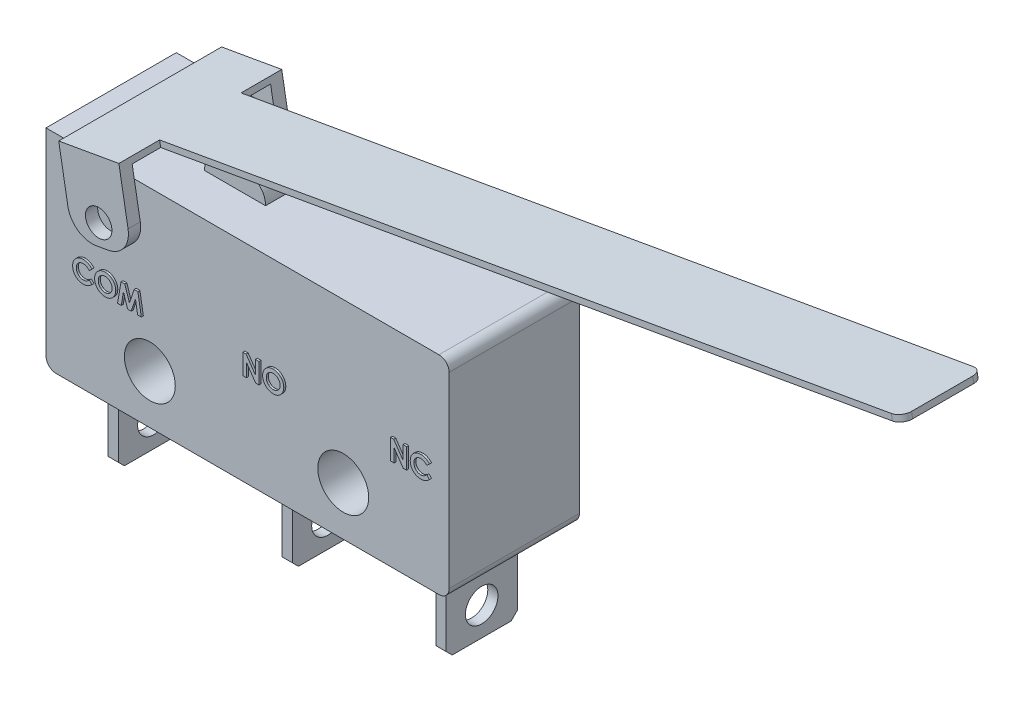
from build123d import *

# Parameters (mm, degrees)
SKETCH1_R           = 1.25
BOSS_EXTRUDE2_DEPTH = 3.2
SKETCH2_W           = 0.5
SKETCH2_H           = 3.5
BOSS_EXTRUDE3_DEPTH = 4
CHAMFER4_SIZE       = 0.3
SKETCH3_R           = 0.8
CUT_EXTRUDE1_DEPTH  = 21.598300901
SKETCH7_W           = 3
SKETCH7_H           = 2
BOSS_EXTRUDE4_DEPTH = 1
FILLET5_R           = 1
SKETCH5_W           = 2
SKETCH5_H           = 3
BOSS_EXTRUDE6_DEPTH = 0.3
SKETCH9_W           = 3
SKETCH9_H           = 0.6
BOSS_EXTRUDE7_DEPTH = 3.5
FILLET6_R           = 1.2
SKETCH13_R          = 0.65
CUT_EXTRUDE2_DEPTH  = 0.6
SKETCH14_R          = 0.65
CUT_EXTRUDE3_DEPTH  = 0.6
BOSS_EXTRUDE8_DEPTH = 0.1


with BuildPart() as part:
    # Sketch1 → Boss-Extrude2 (new, symmetric)
    with BuildSketch(Plane.XY):
        with BuildLine():
            Line((9.65, 5.1), (-9.65, 5.1))
            Line((-9.65, 5.1), (-9.65, -4.6))
            ThreePointArc((-9.65, -4.6), (-9.503553391, -4.953553391), (-9.15, -5.1))
            Line((-9.15, -5.1), (9.65, -5.1))
            ThreePointArc((9.65, -5.1), (10.003553391, -4.953553391), (10.15, -4.6))
            Line((10.15, -4.6), (10.15, 4.6))
            ThreePointArc((10.15, 4.6), (10.003553391, 4.953553391), (9.65, 5.1))
        make_face()
        with Locations((-4.55, -2.7)):
            Circle(SKETCH1_R, mode=Mode.SUBTRACT)
        with Locations((4.95, -2.7)):
            Circle(SKETCH1_R, mode=Mode.SUBTRACT)
    extrude(amount=BOSS_EXTRUDE2_DEPTH, both=True)

    # Sketch2 → Boss-Extrude3 (add)
    with BuildSketch(Plane.XZ.offset(5.1)):
        with Locations((-7.8, 0)):
            Rectangle(SKETCH2_W, SKETCH2_H)
        with Locations((0.75, 0)):
            Rectangle(SKETCH2_W, SKETCH2_H)
        with Locations((8.3, 0)):
            Rectangle(SKETCH2_W, SKETCH2_H)
    extrude(amount=BOSS_EXTRUDE3_DEPTH)

    # Chamfer4
    chamfer4_edges = [part.edges().sort_by_distance(p)[0] for p in [
        (-7.8, -9.1, -1.75),
        (-7.8, -9.1, 1.75),
        (0.75, -9.1, -1.75),
        (0.75, -9.1, 1.75),
        (8.3, -9.1, 1.75),
        (8.3, -9.1, -1.75),
    ]]
    chamfer(chamfer4_edges, length=CHAMFER4_SIZE)

    # Sketch3 → Cut-Extrude1 (cut, through all)
    with BuildSketch(Plane.ZY.offset(8.05)):
        with Locations(Location((0, -7.7, 0), (0, 0, 270))):
            Circle(SKETCH3_R)
    extrude(amount=-CUT_EXTRUDE1_DEPTH, mode=Mode.SUBTRACT)

    # Sketch7 → Boss-Extrude4 (add)
    with BuildSketch(Plane(origin=(0, 5.1, 0), x_dir=(1, 0, 0), z_dir=(0, 1, 0))):
        with Locations((-2.445461134, -0.11924782)):
            Rectangle(SKETCH7_W, SKETCH7_H)
    extrude(amount=BOSS_EXTRUDE4_DEPTH)

    # Fillet5
    fillet5_edges = [part.edges().sort_by_distance(p)[0] for p in [
        (-0.945461134, 6.1, 0.11924782),
        (-3.945461134, 6.1, 0.11924782),
    ]]
    fillet(fillet5_edges, radius=FILLET5_R - 0.0001)  # a hair under: the kernel refuses the full size

    # Sketch15 → Boss-Extrude8 (add)
    # profile 1 of 7: a face of its own
    with BuildSketch(Plane.XY.offset(3.2)):
        with BuildLine():
            Line((-7.291117841, 0.3205553), (-7.422728417, 0.194754018))
            add(Edge.make_bspline(
                [(-7.422728417, 0.194754018), (-7.433892699, 0.206297903), (-7.455700038, 0.228846728), (-7.490839868, 0.258699386), (-7.527384012, 0.283577536), (-7.564621576, 0.304529757), (-7.603222356, 0.320381604), (-7.642740022, 0.331933113), (-7.683426907, 0.338975631), (-7.710962225, 0.33978142), (-7.724811751, 0.34018671)],
                knots=[0, 0, 0, 0, 1.115251505, 2.178435587, 3.19620269, 4.182487026, 5.141301733, 6.088180966, 7.038406374, 8, 8, 8, 8], degree=3))
            add(Edge.make_bspline(
                [(-7.724811751, 0.34018671), (-7.736377788, 0.339866516), (-7.759202087, 0.33923465), (-7.79271414, 0.334602447), (-7.824770151, 0.326725185), (-7.855479852, 0.315868858), (-7.884752878, 0.301821347), (-7.912650605, 0.284593524), (-7.939104252, 0.264340982), (-7.963764381, 0.241168507), (-7.986322601, 0.215850837), (-8.006254224, 0.188836944), (-8.022950156, 0.160188714), (-8.036652235, 0.130196277), (-8.047325626, 0.098720812), (-8.054947767, 0.065783509), (-8.05935621, 0.031345144), (-8.0600142, 0.007934199), (-8.06034861, -0.003963931)],
                knots=[0, 0, 0, 0, 1.035432265, 2.043311493, 3.022114605, 3.98653278, 4.95457646, 5.923598177, 6.917315552, 7.932509744, 8.948865224, 9.949768934, 10.933144597, 11.912367597, 12.897413939, 13.903909035, 14.934704909, 16, 16, 16, 16], degree=3))
            add(Edge.make_bspline(
                [(-8.06034861, -0.003963931), (-8.060252237, -0.012314872), (-8.060062283, -0.028774747), (-8.057982909, -0.053123471), (-8.054634625, -0.07674749), (-8.049788829, -0.099611019), (-8.043729114, -0.121733872), (-8.036619688, -0.143306902), (-8.027701018, -0.164032019), (-8.01780116, -0.18414993), (-8.006287739, -0.203111694), (-7.993874146, -0.22119331), (-7.980413633, -0.238306143), (-7.965819012, -0.254380236), (-7.949884885, -0.269164387), (-7.933023088, -0.283103171), (-7.914949187, -0.295847656), (-7.896038622, -0.307717676), (-7.87612803, -0.318029264), (-7.855757631, -0.327369571), (-7.83461857, -0.334955289), (-7.812968226, -0.341070069), (-7.790883972, -0.346269777), (-7.768149801, -0.349471396), (-7.744962791, -0.351895946), (-7.729292265, -0.352045647), (-7.721406302, -0.352120982)],
                knots=[0, 0, 0, 0, 1.103660481, 2.175337485, 3.227646561, 4.255952547, 5.262355991, 6.258840057, 7.255597736, 8.242457506, 9.22035537, 10.185017736, 11.140346927, 12.096287581, 13.051739095, 14.01125915, 14.986044842, 15.97314143, 16.960198552, 17.947847494, 18.933482797, 19.925264591, 20.920966487, 21.929612487, 22.958107872, 24, 24, 24, 24], degree=3))
            add(Edge.make_bspline(
                [(-7.721406302, -0.352120982), (-7.708030354, -0.351734079), (-7.681750095, -0.350973915), (-7.643180037, -0.345029535), (-7.606426613, -0.335251368), (-7.577060804, -0.323703921), (-7.554053468, -0.312300666), (-7.536538323, -0.301753218), (-7.518426298, -0.289954738), (-7.500018218, -0.276459941), (-7.481107029, -0.261430769), (-7.462026557, -0.244538054), (-7.442288339, -0.22633805), (-7.429358027, -0.21334835), (-7.422728417, -0.20668829)],
                knots=[0, 0, 0, 0, 1.404581149, 2.759636711, 4.088442092, 5.392261763, 6.066678138, 6.783632037, 7.538459478, 8.336747902, 9.180226004, 10.074962426, 11.012997595, 12, 12, 12, 12], degree=3))
            Line((-7.422728417, -0.20668829), (-7.295124251, -0.340702713))
            add(Edge.make_bspline(
                [(-7.295124251, -0.340702713), (-7.304094137, -0.349362857), (-7.321601436, -0.366265605), (-7.348010711, -0.390265929), (-7.374386749, -0.411832889), (-7.40009236, -0.43174927), (-7.425548628, -0.44943486), (-7.450752854, -0.464907321), (-7.475419715, -0.478557974), (-7.500061426, -0.490156608), (-7.524831322, -0.500005053), (-7.550316633, -0.508483918), (-7.576595271, -0.515656732), (-7.603827734, -0.521444252), (-7.631760015, -0.526085061), (-7.660653521, -0.52921758), (-7.690325055, -0.531323469), (-7.710451716, -0.5315127), (-7.72060502, -0.531608162)],
                knots=[0, 0, 0, 0, 1.244526981, 2.429050516, 3.560637417, 4.644440555, 5.67424972, 6.652764056, 7.595344123, 8.486817594, 9.369275933, 10.254498637, 11.166417451, 12.086725134, 13.032340136, 13.991389299, 14.986715468, 16, 16, 16, 16], degree=3))
            add(Edge.make_bspline(
                [(-7.72060502, -0.531608162), (-7.739255381, -0.531132727), (-7.775748954, -0.530202433), (-7.829229333, -0.523309585), (-7.880034257, -0.511753846), (-7.928287326, -0.495410844), (-7.973973196, -0.474533426), (-8.017080179, -0.44893869), (-8.057538796, -0.41869464), (-8.095022221, -0.384155764), (-8.128927764, -0.346010475), (-8.158896337, -0.3050529), (-8.183686341, -0.261081746), (-8.204270016, -0.214746609), (-8.220366179, -0.165836043), (-8.231695149, -0.114297141), (-8.238681643, -0.060179669), (-8.239445975, -0.023216187), (-8.239835789, -0.004364572)],
                knots=[0, 0, 0, 0, 1.078019885, 2.10938526, 3.111377082, 4.085535484, 5.04941344, 6.010039228, 6.978205633, 7.964457913, 8.951525778, 9.924444315, 10.892603023, 11.863865945, 12.85144698, 13.863884204, 14.910567087, 16, 16, 16, 16], degree=3))
            add(Edge.make_bspline(
                [(-8.239835789, -0.004364572), (-8.239671073, 0.00793029), (-8.239344644, 0.032295703), (-8.235913854, 0.06818793), (-8.231131132, 0.103176431), (-8.223543779, 0.13689791), (-8.214397973, 0.169806657), (-8.203023962, 0.201544992), (-8.189439911, 0.232204135), (-8.174083667, 0.261835411), (-8.156711302, 0.290244704), (-8.137304463, 0.317187931), (-8.116362757, 0.342873092), (-8.093382991, 0.366959423), (-8.068699089, 0.389658409), (-8.042199607, 0.410847037), (-8.014043927, 0.430829179), (-7.98415584, 0.449089542), (-7.953115993, 0.465607011), (-7.921315881, 0.480176124), (-7.888833631, 0.492352547), (-7.855806583, 0.502452441), (-7.822095198, 0.509991298), (-7.787940098, 0.515697969), (-7.753050665, 0.518888035), (-7.729625433, 0.519410269), (-7.717800533, 0.519673889)],
                knots=[0, 0, 0, 0, 1.071919942, 2.124283339, 3.142214191, 4.149696895, 5.136002878, 6.119640489, 7.086990633, 8.058538607, 9.028339693, 9.988281803, 10.952401235, 11.916291999, 12.888973767, 13.874849856, 14.873389453, 15.898127285, 16.927174885, 17.938320013, 18.946391617, 19.950418109, 20.947802303, 21.956882652, 22.968648068, 24, 24, 24, 24], degree=3))
            add(Edge.make_bspline(
                [(-7.717800533, 0.519673889), (-7.707712681, 0.519522776), (-7.687641862, 0.519222119), (-7.657753045, 0.516715822), (-7.628103265, 0.512779707), (-7.598798677, 0.506840949), (-7.569629665, 0.499790892), (-7.540979542, 0.490559815), (-7.512396337, 0.48027004), (-7.484328335, 0.467970715), (-7.456736357, 0.454544891), (-7.43026679, 0.439312806), (-7.40447521, 0.423211825), (-7.379933145, 0.405289023), (-7.356180868, 0.386194491), (-7.333342583, 0.365839145), (-7.311618707, 0.3438836), (-7.29798601, 0.328370711), (-7.291117841, 0.3205553)],
                knots=[0, 0, 0, 0, 0.996412454, 1.982464992, 2.961075852, 3.949442424, 4.934965278, 5.923860011, 6.921385422, 7.934793307, 8.949617135, 9.951082467, 10.950285876, 11.951772932, 12.951063433, 13.960125323, 14.972308753, 16, 16, 16, 16], degree=3))
        make_face()
    # profile 2 of 7: a face of its own
    with BuildSketch(Plane.XY.offset(3.2)):
        with BuildLine():
            add(Edge.make_bspline(
                [(-6.641678738, 0.519673889), (-6.624292512, 0.519223729), (-6.589968165, 0.51833501), (-6.539489437, 0.510926845), (-6.490843849, 0.498856302), (-6.444053398, 0.482077375), (-6.399235243, 0.460135604), (-6.356231294, 0.433653054), (-6.315195591, 0.402129881), (-6.276548633, 0.36630147), (-6.240831874, 0.327339638), (-6.209883281, 0.285390298), (-6.183491456, 0.241540401), (-6.161617842, 0.19567245), (-6.144957013, 0.147468786), (-6.13326542, 0.097175185), (-6.125754151, 0.044805956), (-6.124890239, 0.009149648), (-6.124451174, -0.008971944)],
                knots=[0, 0, 0, 0, 1.014329547, 2.002516266, 2.970391464, 3.935626869, 4.897733899, 5.877609409, 6.878433252, 7.912639331, 8.949961323, 9.958554974, 10.949718813, 11.932905612, 12.9188844, 13.919928257, 14.942845884, 16, 16, 16, 16], degree=3))
            add(Edge.make_bspline(
                [(-6.124451174, -0.008971944), (-6.12491876, -0.026889348), (-6.125840152, -0.062196167), (-6.132958777, -0.114082794), (-6.144847258, -0.163837645), (-6.161225506, -0.211573343), (-6.182702416, -0.257058671), (-6.208579571, -0.300584047), (-6.23953982, -0.341745546), (-6.274453922, -0.380521078), (-6.312891317, -0.415718194), (-6.353602621, -0.446735591), (-6.396399853, -0.473018564), (-6.441220373, -0.494555072), (-6.488160294, -0.511268762), (-6.537103672, -0.523061485), (-6.588047475, -0.530228161), (-6.622691732, -0.531143536), (-6.640276494, -0.531608162)],
                knots=[0, 0, 0, 0, 1.051557043, 2.072126891, 3.067553643, 4.050577992, 5.02905126, 6.015227836, 7.017913613, 8.04756643, 9.074058332, 10.072836633, 11.047628519, 12.017157415, 12.98668631, 13.966869689, 14.968021931, 16, 16, 16, 16], degree=3))
            add(Edge.make_bspline(
                [(-6.640276494, -0.531608162), (-6.658668047, -0.531191369), (-6.694804935, -0.530372428), (-6.747691432, -0.522584674), (-6.798361265, -0.510853596), (-6.84638878, -0.493345591), (-6.892263095, -0.471459113), (-6.935647159, -0.444504603), (-6.976526391, -0.412526606), (-7.014666301, -0.376344089), (-7.049221152, -0.33675248), (-7.079722586, -0.294927456), (-7.105451222, -0.251188523), (-7.126408002, -0.205515211), (-7.142929485, -0.158191368), (-7.154583514, -0.108928779), (-7.161467827, -0.057845592), (-7.162426772, -0.02314887), (-7.162912712, -0.005566495)],
                knots=[0, 0, 0, 0, 1.067978421, 2.098431617, 3.099715153, 4.085208694, 5.062210972, 6.048429807, 7.046490867, 8.072918869, 9.098532598, 10.095778865, 11.076610158, 12.041847152, 13.011192615, 13.984257998, 14.978533688, 16, 16, 16, 16], degree=3))
            add(Edge.make_bspline(
                [(-7.162912712, -0.005566495), (-7.162760196, 0.006262006), (-7.162457096, 0.029769233), (-7.158805927, 0.064605744), (-7.153549295, 0.098762293), (-7.145774984, 0.132102697), (-7.136331185, 0.164862158), (-7.124095408, 0.196735742), (-7.110167782, 0.228063947), (-7.093894664, 0.258476747), (-7.075800529, 0.28769432), (-7.056058217, 0.315578841), (-7.034618086, 0.341793145), (-7.011549202, 0.366509502), (-6.986772066, 0.389565449), (-6.960612597, 0.411287376), (-6.932563451, 0.431098271), (-6.903238538, 0.449481955), (-6.872803184, 0.466106002), (-6.841381289, 0.480255894), (-6.809620207, 0.492612753), (-6.777095651, 0.502365333), (-6.74415618, 0.510308707), (-6.710449903, 0.515561797), (-6.676281336, 0.519212864), (-6.65324031, 0.519519849), (-6.641678738, 0.519673889)],
                knots=[0, 0, 0, 0, 1.034744296, 2.056386356, 3.06226378, 4.057406941, 5.050368692, 6.043467995, 7.042652155, 8.049140477, 9.059438543, 10.048523776, 11.036952808, 12.020949711, 13.004946614, 13.997082645, 14.994316842, 16.007702937, 17.024872941, 18.026463647, 19.021641123, 20.005082605, 20.995858141, 21.984425357, 22.988620895, 24, 24, 24, 24], degree=3))
        make_face()
        with BuildLine():
            add(Edge.make_bspline(
                [(-6.644483225, 0.34018671), (-6.656184153, 0.339872748), (-6.679277101, 0.339253112), (-6.713150251, 0.334532326), (-6.745669672, 0.326992695), (-6.776655094, 0.316071631), (-6.806240812, 0.302171889), (-6.834479272, 0.285342035), (-6.860979431, 0.265003563), (-6.88609464, 0.242248354), (-6.9087821, 0.216893821), (-6.928827186, 0.189722128), (-6.945601694, 0.16077865), (-6.95965045, 0.130332265), (-6.970226049, 0.098040612), (-6.977758732, 0.064156634), (-6.982519106, 0.028621949), (-6.983119157, 0.004398), (-6.983425533, -0.007970341)],
                knots=[0, 0, 0, 0, 1.033739768, 2.040188636, 3.016340934, 3.979330865, 4.937572243, 5.900995986, 6.878200029, 7.884839167, 8.891893314, 9.879764717, 10.863503415, 11.843163062, 12.837761627, 13.859916423, 14.907309254, 16, 16, 16, 16], degree=3))
            add(Edge.make_bspline(
                [(-6.983425533, -0.007970341), (-6.983019325, -0.021677246), (-6.982223225, -0.048540508), (-6.976621769, -0.087727911), (-6.967038234, -0.124736524), (-6.953199797, -0.159385343), (-6.936036505, -0.192059117), (-6.914722419, -0.222357383), (-6.889602728, -0.250461553), (-6.870250721, -0.266869938), (-6.860428738, -0.275197906)],
                knots=[0, 0, 0, 0, 1.078454662, 2.113592447, 3.107694534, 4.079536787, 5.043276885, 6.005368276, 6.987637804, 8, 8, 8, 8], degree=3))
            add(Edge.make_bspline(
                [(-6.860428738, -0.275197906), (-6.852382658, -0.281350288), (-6.836471779, -0.293516439), (-6.811074551, -0.309109858), (-6.784920407, -0.322474973), (-6.757811982, -0.333273828), (-6.729806526, -0.341768026), (-6.700907881, -0.347716373), (-6.671156992, -0.351449475), (-6.651038048, -0.351895652), (-6.640877456, -0.352120982)],
                knots=[0, 0, 0, 0, 1.023928204, 2.024787132, 3.009472467, 3.9914905, 4.972207045, 5.96565515, 6.972602802, 8, 8, 8, 8], degree=3))
            add(Edge.make_bspline(
                [(-6.640877456, -0.352120982), (-6.629377726, -0.351804358), (-6.606751646, -0.35118139), (-6.573509063, -0.34651872), (-6.541661659, -0.338627799), (-6.511011722, -0.327802538), (-6.481647634, -0.313728273), (-6.453712904, -0.29637641), (-6.427158555, -0.275960008), (-6.402075341, -0.252905973), (-6.379148099, -0.227451561), (-6.359144843, -0.200134937), (-6.341836989, -0.171557967), (-6.328080377, -0.141316187), (-6.317086959, -0.109695066), (-6.309644937, -0.076554561), (-6.304844348, -0.04203129), (-6.304244128, -0.018536983), (-6.303938353, -0.006568098)],
                knots=[0, 0, 0, 0, 1.026359118, 2.019393844, 2.989460624, 3.950973911, 4.916101784, 5.890408035, 6.881132271, 7.902007068, 8.92769091, 9.933912415, 10.920395702, 11.90457117, 12.894218921, 13.903490204, 14.931958862, 16, 16, 16, 16], degree=3))
            add(Edge.make_bspline(
                [(-6.303938353, -0.006568098), (-6.304254708, 0.005331963), (-6.304877404, 0.028755419), (-6.309548281, 0.063189931), (-6.31738916, 0.096184131), (-6.328246927, 0.1277919), (-6.342111721, 0.158044227), (-6.359256946, 0.186834726), (-6.37962244, 0.214135563), (-6.402739494, 0.239760695), (-6.427900986, 0.26330855), (-6.454914362, 0.283743807), (-6.483023757, 0.301501396), (-6.512874138, 0.315411974), (-6.543854791, 0.326494502), (-6.576154761, 0.334655835), (-6.609896388, 0.339219948), (-6.632851514, 0.339861583), (-6.644483225, 0.34018671)],
                knots=[0, 0, 0, 0, 1.055025985, 2.07665775, 3.074803781, 4.057872707, 5.035505728, 6.020516407, 7.023567878, 8.050795229, 9.077271434, 10.074415901, 11.050397877, 12.019801805, 12.988065821, 13.964604439, 14.968634123, 16, 16, 16, 16], degree=3))
        make_face(mode=Mode.SUBTRACT)
    # profile 3 of 7: a face of its own
    with BuildSketch(Plane.XY.offset(3.2)):
        Polygon((-5.865837392, 0.494032864), (-5.679539315, 0.494032864), (-5.451374251, -0.203483162), (-5.221606623, 0.494032864), (-5.03711143, 0.494032864), (-4.868040917, -0.505967136), (-5.049731623, -0.505967136), (-5.156502456, 0.125643441), (-5.364435148, -0.505967136), (-5.539515276, -0.505967136), (-5.746246046, 0.125643441), (-5.852816559, -0.505967136), (-6.034707584, -0.505967136), align=None)
    # profile 4 of 7: a face of its own
    with BuildSketch(Plane.XY.offset(3.2)):
        Polygon((0.115384615, 0.494032864), (0.277043269, 0.494032864), (0.730769231, -0.164020021), (0.730769231, 0.494032864), (0.91025641, 0.494032864), (0.91025641, -0.505967136), (0.747395833, -0.505967136), (0.294871795, 0.150082543), (0.294871795, -0.505967136), (0.115384615, -0.505967136), align=None)
    # profile 5 of 7: a face of its own
    with BuildSketch(Plane.XY.offset(3.2)):
        with BuildLine():
            add(Edge.make_bspline(
                [(1.610977564, 0.519673889), (1.62836379, 0.519223729), (1.662688137, 0.51833501), (1.713166865, 0.510926845), (1.761812453, 0.498856302), (1.808602904, 0.482077375), (1.853421059, 0.460135604), (1.896425008, 0.433653054), (1.937460712, 0.402129881), (1.976107669, 0.36630147), (2.011824429, 0.327339638), (2.042773021, 0.285390298), (2.069164846, 0.241540401), (2.09103846, 0.19567245), (2.107699289, 0.147468786), (2.119390882, 0.097175185), (2.126902151, 0.044805956), (2.127766063, 0.009149648), (2.128205128, -0.008971944)],
                knots=[0, 0, 0, 0, 1.014329547, 2.002516266, 2.970391464, 3.935626869, 4.897733899, 5.877609409, 6.878433252, 7.912639331, 8.949961323, 9.958554974, 10.949718813, 11.932905612, 12.9188844, 13.919928257, 14.942845884, 16, 16, 16, 16], degree=3))
            add(Edge.make_bspline(
                [(2.128205128, -0.008971944), (2.127737543, -0.026889348), (2.12681615, -0.062196167), (2.119697525, -0.114082794), (2.107809044, -0.163837645), (2.091430796, -0.211573343), (2.069953886, -0.257058671), (2.044076731, -0.300584047), (2.013116482, -0.341745546), (1.97820238, -0.380521078), (1.939764985, -0.415718194), (1.899053681, -0.446735591), (1.856256449, -0.473018564), (1.81143593, -0.494555072), (1.764496008, -0.511268762), (1.715552631, -0.523061485), (1.664608827, -0.530228161), (1.62996457, -0.531143536), (1.612379808, -0.531608162)],
                knots=[0, 0, 0, 0, 1.051557043, 2.072126891, 3.067553643, 4.050577992, 5.02905126, 6.015227836, 7.017913613, 8.04756643, 9.074058332, 10.072836633, 11.047628519, 12.017157415, 12.98668631, 13.966869689, 14.968021931, 16, 16, 16, 16], degree=3))
            add(Edge.make_bspline(
                [(1.612379808, -0.531608162), (1.593988255, -0.531191369), (1.557851367, -0.530372428), (1.50496487, -0.522584674), (1.454295037, -0.510853596), (1.406267522, -0.493345591), (1.360393207, -0.471459113), (1.317009143, -0.444504603), (1.276129911, -0.412526606), (1.237990001, -0.376344089), (1.20343515, -0.33675248), (1.172933716, -0.294927456), (1.14720508, -0.251188523), (1.1262483, -0.205515211), (1.109726817, -0.158191368), (1.098072788, -0.108928779), (1.091188475, -0.057845592), (1.09022953, -0.02314887), (1.08974359, -0.005566495)],
                knots=[0, 0, 0, 0, 1.067978421, 2.098431617, 3.099715153, 4.085208694, 5.062210972, 6.048429807, 7.046490867, 8.072918869, 9.098532598, 10.095778865, 11.076610158, 12.041847152, 13.011192615, 13.984257998, 14.978533688, 16, 16, 16, 16], degree=3))
            add(Edge.make_bspline(
                [(1.08974359, -0.005566495), (1.089896106, 0.006262006), (1.090199207, 0.029769233), (1.093850375, 0.064605744), (1.099107007, 0.098762293), (1.106881318, 0.132102697), (1.116325118, 0.164862158), (1.128560894, 0.196735742), (1.14248852, 0.228063947), (1.158761638, 0.258476747), (1.176855773, 0.28769432), (1.196598085, 0.315578841), (1.218038216, 0.341793145), (1.2411071, 0.366509502), (1.265884236, 0.389565449), (1.292043706, 0.411287376), (1.320092851, 0.431098271), (1.349417764, 0.449481955), (1.379853118, 0.466106002), (1.411275013, 0.480255894), (1.443036095, 0.492612753), (1.475560651, 0.502365333), (1.508500122, 0.510308707), (1.542206399, 0.515561797), (1.576374966, 0.519212864), (1.599415992, 0.519519849), (1.610977564, 0.519673889)],
                knots=[0, 0, 0, 0, 1.034744296, 2.056386356, 3.06226378, 4.057406941, 5.050368692, 6.043467995, 7.042652155, 8.049140477, 9.059438543, 10.048523776, 11.036952808, 12.020949711, 13.004946614, 13.997082645, 14.994316842, 16.007702937, 17.024872941, 18.026463647, 19.021641123, 20.005082605, 20.995858141, 21.984425357, 22.988620895, 24, 24, 24, 24], degree=3))
        make_face()
        with BuildLine():
            add(Edge.make_bspline(
                [(1.608173077, 0.34018671), (1.596472149, 0.339872748), (1.573379201, 0.339253112), (1.539506051, 0.334532326), (1.506986631, 0.326992695), (1.476001208, 0.316071631), (1.44641549, 0.302171889), (1.41817703, 0.285342035), (1.391676872, 0.265003563), (1.366561662, 0.242248354), (1.343874203, 0.216893821), (1.323829117, 0.189722128), (1.307054608, 0.16077865), (1.293005852, 0.130332265), (1.282430253, 0.098040612), (1.27489757, 0.064156634), (1.270137196, 0.028621949), (1.269537145, 0.004398), (1.269230769, -0.007970341)],
                knots=[0, 0, 0, 0, 1.033739768, 2.040188636, 3.016340934, 3.979330865, 4.937572243, 5.900995986, 6.878200029, 7.884839167, 8.891893314, 9.879764717, 10.863503415, 11.843163062, 12.837761627, 13.859916423, 14.907309254, 16, 16, 16, 16], degree=3))
            add(Edge.make_bspline(
                [(1.269230769, -0.007970341), (1.269636977, -0.021677246), (1.270433077, -0.048540508), (1.276034533, -0.087727911), (1.285618068, -0.124736524), (1.299456505, -0.159385343), (1.316619798, -0.192059117), (1.337933883, -0.222357383), (1.363053574, -0.250461553), (1.382405581, -0.266869938), (1.392227564, -0.275197906)],
                knots=[0, 0, 0, 0, 1.078454662, 2.113592447, 3.107694534, 4.079536787, 5.043276885, 6.005368276, 6.987637804, 8, 8, 8, 8], degree=3))
            add(Edge.make_bspline(
                [(1.392227564, -0.275197906), (1.400273644, -0.281350288), (1.416184523, -0.293516439), (1.441581751, -0.309109858), (1.467735895, -0.322474973), (1.494844321, -0.333273828), (1.522849776, -0.341768026), (1.551748422, -0.347716373), (1.58149931, -0.351449475), (1.601618254, -0.351895652), (1.611778846, -0.352120982)],
                knots=[0, 0, 0, 0, 1.023928204, 2.024787132, 3.009472467, 3.9914905, 4.972207045, 5.96565515, 6.972602802, 8, 8, 8, 8], degree=3))
            add(Edge.make_bspline(
                [(1.611778846, -0.352120982), (1.623278576, -0.351804358), (1.645904656, -0.35118139), (1.679147239, -0.34651872), (1.710994643, -0.338627799), (1.74164458, -0.327802538), (1.771008668, -0.313728273), (1.798943399, -0.29637641), (1.825497747, -0.275960008), (1.850580961, -0.252905973), (1.873508203, -0.227451561), (1.893511459, -0.200134937), (1.910819313, -0.171557967), (1.924575925, -0.141316187), (1.935569343, -0.109695066), (1.943011365, -0.076554561), (1.947811954, -0.04203129), (1.948412174, -0.018536983), (1.948717949, -0.006568098)],
                knots=[0, 0, 0, 0, 1.026359118, 2.019393844, 2.989460624, 3.950973911, 4.916101784, 5.890408035, 6.881132271, 7.902007068, 8.92769091, 9.933912415, 10.920395702, 11.90457117, 12.894218921, 13.903490204, 14.931958862, 16, 16, 16, 16], degree=3))
            add(Edge.make_bspline(
                [(1.948717949, -0.006568098), (1.948401594, 0.005331963), (1.947778898, 0.028755419), (1.943108022, 0.063189931), (1.935267142, 0.096184131), (1.924409375, 0.1277919), (1.910544581, 0.158044227), (1.893399356, 0.186834726), (1.873033862, 0.214135563), (1.849916808, 0.239760695), (1.824755316, 0.26330855), (1.79774194, 0.283743807), (1.769632545, 0.301501396), (1.739782164, 0.315411974), (1.708801511, 0.326494502), (1.676501541, 0.334655835), (1.642759914, 0.339219948), (1.619804788, 0.339861583), (1.608173077, 0.34018671)],
                knots=[0, 0, 0, 0, 1.055025985, 2.07665775, 3.074803781, 4.057872707, 5.035505728, 6.020516407, 7.023567878, 8.050795229, 9.077271434, 10.074415901, 11.050397877, 12.019801805, 12.988065821, 13.964604439, 14.968634123, 16, 16, 16, 16], degree=3))
        make_face(mode=Mode.SUBTRACT)
    # profile 6 of 7: a face of its own
    with BuildSketch(Plane.XY.offset(3.2)):
        Polygon((7.365984236, 0.494032864), (7.52764289, 0.494032864), (7.981368851, -0.164020021), (7.981368851, 0.494032864), (8.160856031, 0.494032864), (8.160856031, -0.505967136), (7.997995454, -0.505967136), (7.545471415, 0.150082543), (7.545471415, -0.505967136), (7.365984236, -0.505967136), align=None)
    # profile 7 of 7: a face of its own
    with BuildSketch(Plane.XY.offset(3.2)):
        with BuildLine():
            Line((9.289061159, 0.3205553), (9.157450582, 0.194754018))
            add(Edge.make_bspline(
                [(9.157450582, 0.194754018), (9.146286301, 0.206297903), (9.124478962, 0.228846728), (9.089339132, 0.258699386), (9.052794988, 0.283577536), (9.015557424, 0.304529757), (8.976956644, 0.320381604), (8.937438977, 0.331933113), (8.896752093, 0.338975631), (8.869216774, 0.33978142), (8.855367249, 0.34018671)],
                knots=[0, 0, 0, 0, 1.115251505, 2.178435587, 3.19620269, 4.182487026, 5.141301733, 6.088180966, 7.038406374, 8, 8, 8, 8], degree=3))
            add(Edge.make_bspline(
                [(8.855367249, 0.34018671), (8.843801212, 0.339866516), (8.820976912, 0.33923465), (8.787464859, 0.334602447), (8.755408849, 0.326725185), (8.724699148, 0.315868858), (8.695426121, 0.301821347), (8.667528394, 0.284593524), (8.641074747, 0.264340982), (8.616414618, 0.241168507), (8.593856399, 0.215850837), (8.573924776, 0.188836944), (8.557228844, 0.160188714), (8.543526764, 0.130196277), (8.532853374, 0.098720812), (8.525231232, 0.065783509), (8.520822789, 0.031345144), (8.5201648, 0.007934199), (8.51983039, -0.003963931)],
                knots=[0, 0, 0, 0, 1.035432265, 2.043311493, 3.022114605, 3.98653278, 4.95457646, 5.923598177, 6.917315552, 7.932509744, 8.948865224, 9.949768934, 10.933144597, 11.912367597, 12.897413939, 13.903909035, 14.934704909, 16, 16, 16, 16], degree=3))
            add(Edge.make_bspline(
                [(8.51983039, -0.003963931), (8.519926763, -0.012314872), (8.520116716, -0.028774747), (8.522196091, -0.053123471), (8.525544374, -0.07674749), (8.53039017, -0.099611019), (8.536449885, -0.121733872), (8.543559311, -0.143306902), (8.552477981, -0.164032019), (8.56237784, -0.18414993), (8.573891261, -0.203111694), (8.586304853, -0.22119331), (8.599765367, -0.238306143), (8.614359987, -0.254380236), (8.630294115, -0.269164387), (8.647155912, -0.283103171), (8.665229813, -0.295847656), (8.684140378, -0.307717676), (8.70405097, -0.318029264), (8.724421368, -0.327369571), (8.74556043, -0.334955289), (8.767210773, -0.341070069), (8.789295028, -0.346269777), (8.812029199, -0.349471396), (8.835216208, -0.351895946), (8.850886735, -0.352045647), (8.858772698, -0.352120982)],
                knots=[0, 0, 0, 0, 1.103660481, 2.175337485, 3.227646561, 4.255952547, 5.262355991, 6.258840057, 7.255597736, 8.242457506, 9.22035537, 10.185017736, 11.140346927, 12.096287581, 13.051739095, 14.01125915, 14.986044842, 15.97314143, 16.960198552, 17.947847494, 18.933482797, 19.925264591, 20.920966487, 21.929612487, 22.958107872, 24, 24, 24, 24], degree=3))
            add(Edge.make_bspline(
                [(8.858772698, -0.352120982), (8.872148645, -0.351734079), (8.898428904, -0.350973915), (8.936998963, -0.345029535), (8.973752386, -0.335251368), (9.003118196, -0.323703921), (9.026125532, -0.312300666), (9.043640677, -0.301753218), (9.061752702, -0.289954738), (9.080160781, -0.276459941), (9.09907197, -0.261430769), (9.118152442, -0.244538054), (9.137890661, -0.22633805), (9.150820972, -0.21334835), (9.157450582, -0.20668829)],
                knots=[0, 0, 0, 0, 1.404581149, 2.759636711, 4.088442092, 5.392261763, 6.066678138, 6.783632037, 7.538459478, 8.336747902, 9.180226004, 10.074962426, 11.012997595, 12, 12, 12, 12], degree=3))
            Line((9.157450582, -0.20668829), (9.285054749, -0.340702713))
            add(Edge.make_bspline(
                [(9.285054749, -0.340702713), (9.276084863, -0.349362857), (9.258577563, -0.366265605), (9.232168288, -0.390265929), (9.20579225, -0.411832889), (9.18008664, -0.43174927), (9.154630372, -0.44943486), (9.129426146, -0.464907321), (9.104759284, -0.478557974), (9.080117573, -0.490156608), (9.055347678, -0.500005053), (9.029862367, -0.508483918), (9.003583729, -0.515656732), (8.976351265, -0.521444252), (8.948418985, -0.526085061), (8.919525478, -0.52921758), (8.889853944, -0.531323469), (8.869727283, -0.5315127), (8.85957398, -0.531608162)],
                knots=[0, 0, 0, 0, 1.244526981, 2.429050516, 3.560637417, 4.644440555, 5.67424972, 6.652764056, 7.595344123, 8.486817594, 9.369275933, 10.254498637, 11.166417451, 12.086725134, 13.032340136, 13.991389299, 14.986715468, 16, 16, 16, 16], degree=3))
            add(Edge.make_bspline(
                [(8.85957398, -0.531608162), (8.840923618, -0.531132727), (8.804430046, -0.530202433), (8.750949667, -0.523309585), (8.700144742, -0.511753846), (8.651891674, -0.495410844), (8.606205804, -0.474533426), (8.563098821, -0.44893869), (8.522640204, -0.41869464), (8.485156778, -0.384155764), (8.451251236, -0.346010475), (8.421282663, -0.3050529), (8.396492658, -0.261081746), (8.375908983, -0.214746609), (8.35981282, -0.165836043), (8.34848385, -0.114297141), (8.341497357, -0.060179669), (8.340733025, -0.023216187), (8.34034321, -0.004364572)],
                knots=[0, 0, 0, 0, 1.078019885, 2.10938526, 3.111377082, 4.085535484, 5.04941344, 6.010039228, 6.978205633, 7.964457913, 8.951525778, 9.924444315, 10.892603023, 11.863865945, 12.85144698, 13.863884204, 14.910567087, 16, 16, 16, 16], degree=3))
            add(Edge.make_bspline(
                [(8.34034321, -0.004364572), (8.340507927, 0.00793029), (8.340834355, 0.032295703), (8.344265146, 0.06818793), (8.349047868, 0.103176431), (8.356635221, 0.13689791), (8.365781026, 0.169806657), (8.377155038, 0.201544992), (8.390739088, 0.232204135), (8.406095332, 0.261835411), (8.423467698, 0.290244704), (8.442874537, 0.317187931), (8.463816242, 0.342873092), (8.486796009, 0.366959423), (8.511479911, 0.389658409), (8.537979392, 0.410847037), (8.566135073, 0.430829179), (8.59602316, 0.449089542), (8.627063006, 0.465607011), (8.658863119, 0.480176124), (8.691345368, 0.492352547), (8.724372416, 0.502452441), (8.758083802, 0.509991298), (8.792238902, 0.515697969), (8.827128335, 0.518888035), (8.850553567, 0.519410269), (8.862378467, 0.519673889)],
                knots=[0, 0, 0, 0, 1.071919942, 2.124283339, 3.142214191, 4.149696895, 5.136002878, 6.119640489, 7.086990633, 8.058538607, 9.028339693, 9.988281803, 10.952401235, 11.916291999, 12.888973767, 13.874849856, 14.873389453, 15.898127285, 16.927174885, 17.938320013, 18.946391617, 19.950418109, 20.947802303, 21.956882652, 22.968648068, 24, 24, 24, 24], degree=3))
            add(Edge.make_bspline(
                [(8.862378467, 0.519673889), (8.872466319, 0.519522776), (8.892537137, 0.519222119), (8.922425954, 0.516715822), (8.952075734, 0.512779707), (8.981380322, 0.506840949), (9.010549335, 0.499790892), (9.039199458, 0.490559815), (9.067782663, 0.48027004), (9.095850665, 0.467970715), (9.123442642, 0.454544891), (9.14991221, 0.439312806), (9.175703789, 0.423211825), (9.200245855, 0.405289023), (9.223998131, 0.386194491), (9.246836417, 0.365839145), (9.268560292, 0.3438836), (9.28219299, 0.328370711), (9.289061159, 0.3205553)],
                knots=[0, 0, 0, 0, 0.996412454, 1.982464992, 2.961075852, 3.949442424, 4.934965278, 5.923860011, 6.921385422, 7.934793307, 8.949617135, 9.951082467, 10.950285876, 11.951772932, 12.951063433, 13.960125323, 14.972308753, 16, 16, 16, 16], degree=3))
        make_face()
    extrude(amount=BOSS_EXTRUDE8_DEPTH)


with BuildPart() as body_2:
    # Sketch5 → Boss-Extrude6 (new body)
    with BuildSketch(Plane(origin=(-1.16313447, 6.596463375, 0), x_dir=(0, 0, -1), z_dir=(0.17364817766693072, -0.984807753012208, 0))):
        with BuildLine():
            Line((1.5, 32.88221089), (-1.5, 32.88221089))
            ThreePointArc((-1.5, 32.88221089), (-1.853553391, 32.73576428), (-2, 32.38221089))
            Line((-2, 32.38221089), (-2, -7.11778911))
            Line((-2, -7.11778911), (2, -7.11778911))
            Line((2, -7.11778911), (2, 32.38221089))
            ThreePointArc((2, 32.38221089), (1.853553391, 32.73576428), (1.5, 32.88221089))
        make_face()
        with Locations((3, -5.61778911)):
            Rectangle(SKETCH5_W, SKETCH5_H)
        with Locations((-3, -5.61778911)):
            Rectangle(SKETCH5_W, SKETCH5_H)
    extrude(amount=-BOSS_EXTRUDE6_DEPTH)

    # Sketch9 → Boss-Extrude7 (add)
    with BuildSketch(Plane(origin=(-1.16313447, 6.596463375, 0), x_dir=(0.9848077530122081, 0.17364817766693072, 0), z_dir=(0.17364817766693072, -0.9848077530122081, 0))):
        with Locations((-5.61778911, 3.7)):
            Rectangle(SKETCH9_W, SKETCH9_H)
        with Locations((-5.61778911, -3.7)):
            Rectangle(SKETCH9_W, SKETCH9_H)
    extrude(amount=BOSS_EXTRUDE7_DEPTH)

    # Fillet6
    fillet6_edges = [body_2.edges().sort_by_distance(p)[0] for p in [
        (-4.61059649, 2.434589664, -3.7),
        (-7.565019749, 1.913645131, -3.7),
        (-4.61059649, 2.434589664, 3.7),
        (-7.565019749, 1.913645131, 3.7),
    ]]
    fillet(fillet6_edges, radius=FILLET6_R)

    # Sketch13 → Cut-Extrude2 (cut)
    with BuildSketch(Plane.XY.offset(4)):
        with Locations((-6.261456297, 3.15892515)):
            Circle(SKETCH13_R)
    extrude(amount=-CUT_EXTRUDE2_DEPTH, mode=Mode.SUBTRACT)

    # Sketch14 → Cut-Extrude3 (cut)
    with BuildSketch(Plane(origin=(0, 0, -4), x_dir=(-1, 0, 0), z_dir=(0, 0, -1))):
        with Locations(Location((6.261456297, 3.15892515, 0), (0, 0, 180))):
            Circle(SKETCH14_R)
    extrude(amount=-CUT_EXTRUDE3_DEPTH, mode=Mode.SUBTRACT)


solid = Compound([part.part, body_2.part])
